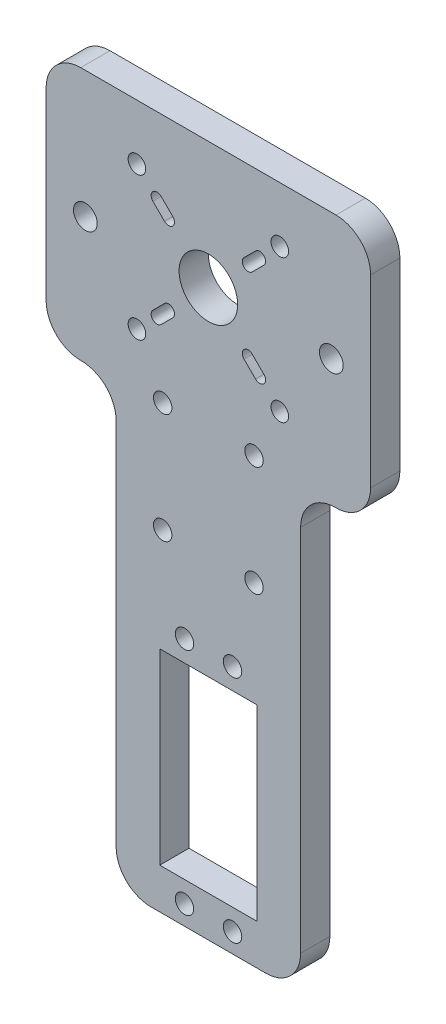
from build123d import *

# Parameters (mm, degrees)
SKETCH1_R           = 2
SKETCH1_W           = 21.082
SKETCH1_H           = 40.64
SKETCH1_R_2         = 1.905
SKETCH1_R_3         = 2.575
SKETCH1_R_4         = 6.35
BOSS_EXTRUDE1_DEPTH = 3.175
FILLET1_R           = 7.5


with BuildPart() as part:
    # Sketch1 → Boss-Extrude1 (new, symmetric)
    with BuildSketch(Plane.XY):
        Polygon((-20, 11), (-20, -84), (20, -84), (20, 11), (35.179, 11), (35.179, 66), (-35.179, 66), (-35.179, 11), align=None)
        with Locations((-5.1689, -79.784)):
            Circle(SKETCH1_R, mode=Mode.SUBTRACT)
        with Locations((-5.1689, -30)):
            Circle(SKETCH1_R, mode=Mode.SUBTRACT)
        with Locations((-9.906, -11.938)):
            Circle(SKETCH1_R, mode=Mode.SUBTRACT)
        with Locations((5.2451, -79.784)):
            Circle(SKETCH1_R, mode=Mode.SUBTRACT)
        with Locations((0, -54.892)):
            Rectangle(SKETCH1_W, SKETCH1_H, mode=Mode.SUBTRACT)
        with Locations((5.2451, -30)):
            Circle(SKETCH1_R, mode=Mode.SUBTRACT)
        with Locations((9.906, -11.938)):
            Circle(SKETCH1_R, mode=Mode.SUBTRACT)
        with Locations((-9.906, 11.938)):
            Circle(SKETCH1_R, mode=Mode.SUBTRACT)
        with Locations((-15.494, 23.006)):
            Circle(SKETCH1_R_2, mode=Mode.SUBTRACT)
        with Locations((-26.67, 38.5)):
            Circle(SKETCH1_R_3, mode=Mode.SUBTRACT)
        with BuildLine():
            ThreePointArc((-9.519071488, 30.776979736), (-7.723020264, 30.776979736), (-7.723020264, 28.980928512))
            Line((-7.723020264, 28.980928512), (-10.237491978, 26.466456798))
            ThreePointArc((-10.237491978, 26.466456798), (-12.033543202, 26.466456798), (-12.033543202, 28.262508022))
            Line((-12.033543202, 28.262508022), (-9.519071488, 30.776979736))
        make_face(mode=Mode.SUBTRACT)
        with Locations((-15.494, 53.994)):
            Circle(SKETCH1_R_2, mode=Mode.SUBTRACT)
        with BuildLine():
            ThreePointArc((-7.723020264, 48.019071488), (-7.723020264, 46.223020264), (-9.519071488, 46.223020264))
            Line((-9.519071488, 46.223020264), (-12.033543202, 48.737491978))
            ThreePointArc((-12.033543202, 48.737491978), (-12.033543202, 50.533543202), (-10.237491978, 50.533543202))
            Line((-10.237491978, 50.533543202), (-7.723020264, 48.019071488))
        make_face(mode=Mode.SUBTRACT)
        with Locations((9.906, 11.938)):
            Circle(SKETCH1_R, mode=Mode.SUBTRACT)
        with Locations((15.494, 23.006)):
            Circle(SKETCH1_R_2, mode=Mode.SUBTRACT)
        with Locations((0, 38.5)):
            Circle(SKETCH1_R_4, mode=Mode.SUBTRACT)
        with BuildLine():
            ThreePointArc((7.723020264, 28.980928512), (7.723020264, 30.776979736), (9.519071488, 30.776979736))
            Line((9.519071488, 30.776979736), (12.033543202, 28.262508022))
            ThreePointArc((12.033543202, 28.262508022), (12.033543202, 26.466456798), (10.237491978, 26.466456798))
            Line((10.237491978, 26.466456798), (7.723020264, 28.980928512))
        make_face(mode=Mode.SUBTRACT)
        with BuildLine():
            ThreePointArc((9.519071488, 46.223020264), (7.723020264, 46.223020264), (7.723020264, 48.019071488))
            Line((7.723020264, 48.019071488), (10.237491978, 50.533543202))
            ThreePointArc((10.237491978, 50.533543202), (12.033543202, 50.533543202), (12.033543202, 48.737491978))
            Line((12.033543202, 48.737491978), (9.519071488, 46.223020264))
        make_face(mode=Mode.SUBTRACT)
        with Locations((15.494, 53.994)):
            Circle(SKETCH1_R_2, mode=Mode.SUBTRACT)
        with Locations((26.67, 38.5)):
            Circle(SKETCH1_R_3, mode=Mode.SUBTRACT)
    extrude(amount=BOSS_EXTRUDE1_DEPTH, both=True)

    # Fillet1
    fillet1_edges = [part.edges().sort_by_distance(p)[0] for p in [
        (-20, -84, 0),
        (20, -84, 0),
        (20, 11, 0),
        (35.179, 11, 0),
        (35.179, 66, 0),
        (-20, 11, 0),
        (-35.179, 11, 0),
        (-35.179, 66, 0),
    ]]
    fillet(fillet1_edges, radius=FILLET1_R)


solid = part.part
